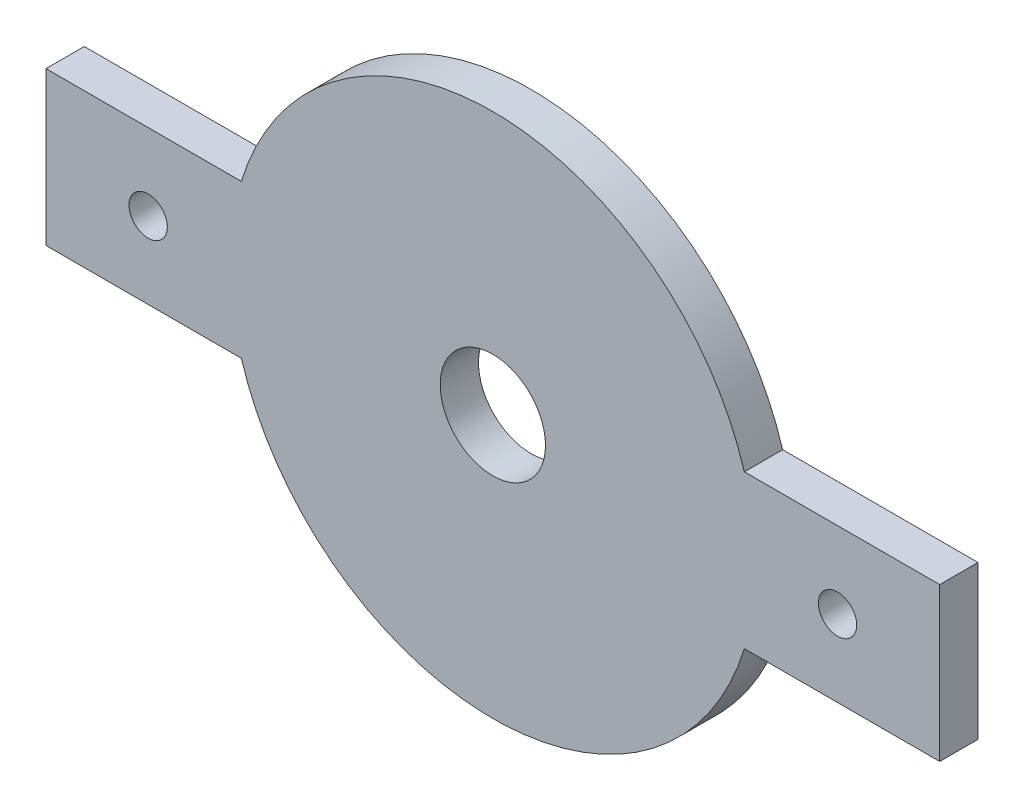
from build123d import *

# Parameters (mm, degrees)
SKETCH2_R           = 20.592109163
SKETCH2_R_2         = 4.125
BOSS_EXTRUDE1_DEPTH = 3
SKETCH3_W           = 70
SKETCH3_H           = 12
SKETCH3_R           = 1.5
SKETCH3_R_2         = 4.125
BOSS_EXTRUDE2_DEPTH = 3


# Read off the part's stored shape, not the designer's step: Gear 60pitch part02.STEP
with BuildPart() as part:
    # Sketch2 → Boss-Extrude1 (new body)
    with BuildSketch(Plane.XY.offset(1)):
        Circle(SKETCH2_R)
        Circle(SKETCH2_R_2, mode=Mode.SUBTRACT)
    extrude(amount=BOSS_EXTRUDE1_DEPTH)

    # Sketch3 → Boss-Extrude2 (add)
    with BuildSketch(Plane(origin=(0, 0, 1), x_dir=(-1, 0, 0), z_dir=(0, 0, -1))):
        Rectangle(SKETCH3_W, SKETCH3_H)
        with Locations((-27, 0)):
            Circle(SKETCH3_R, mode=Mode.SUBTRACT)
        with Locations((27, 0)):
            Circle(SKETCH3_R, mode=Mode.SUBTRACT)
        with Locations(Location((0, 0, 0), (0, 0, 180))):
            Circle(SKETCH3_R_2, mode=Mode.SUBTRACT)
    extrude(amount=-BOSS_EXTRUDE2_DEPTH)


solid = part.part
